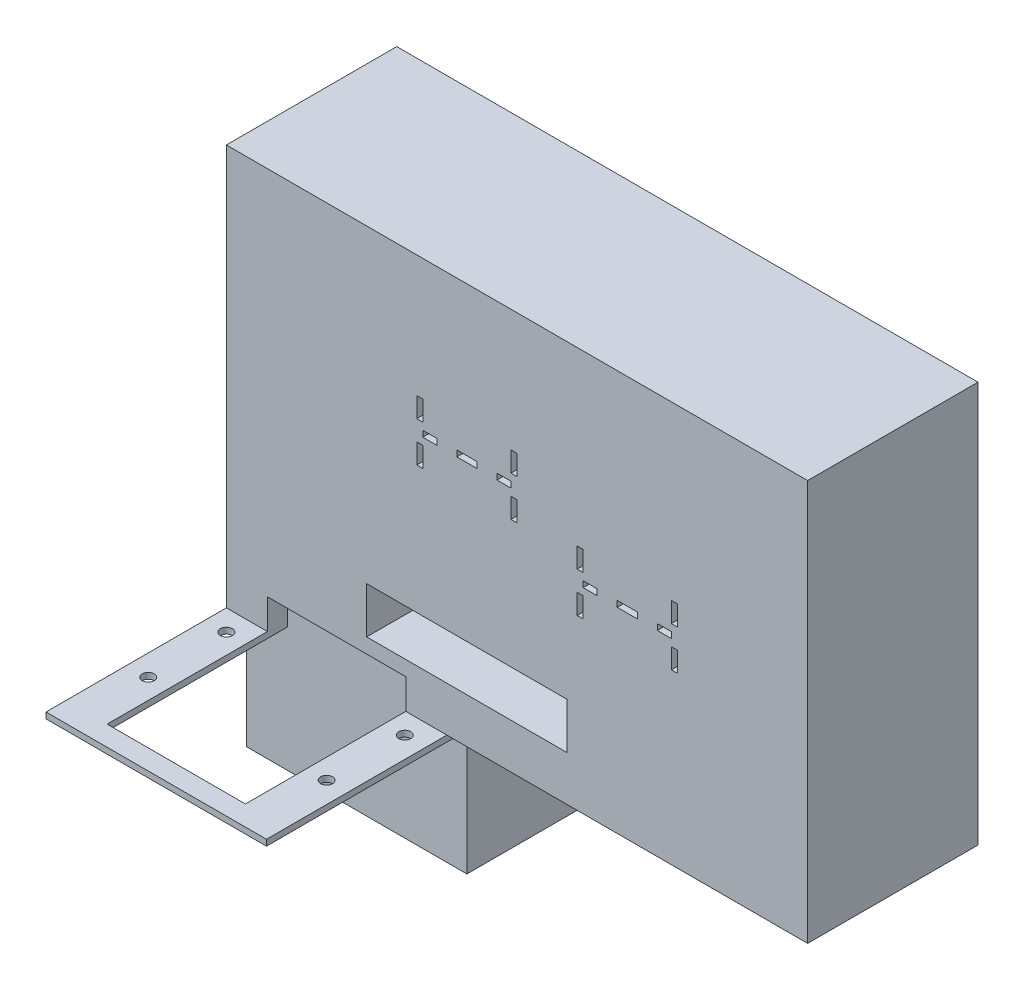
from build123d import *

# Parameters (mm, degrees)
CROQUIS1_W              = 110
CROQUIS1_H              = 65
SALIENTE_EXTRUIR1_DEPTH = 75
CROQUIS3_W              = 110
CROQUIS3_H              = 3
SALIENTE_EXTRUIR2_DEPTH = 70
CROQUIS4_R              = 3
CORTAR_EXTRUIR1_DEPTH   = 70
SALIENTE_EXTRUIR3_DEPTH = 3
CROQUIS7_W              = 290
CROQUIS7_H              = 85
SALIENTE_EXTRUIR4_DEPTH = 200
CROQUIS8_W              = 69
CROQUIS8_H              = 15
CORTAR_EXTRUIR2_DEPTH   = 10
CORTAR_EXTRUIR3_DEPTH   = 50
CROQUIS12_W             = 10
CROQUIS12_H             = 3
CROQUIS12_W_2           = 7
CROQUIS12_W_3           = 3
CROQUIS12_H_2           = 10
CORTAR_EXTRUIR4_DEPTH   = 3


with BuildPart() as part:
    # Croquis1 → Saliente-Extruir1 (new body)
    with BuildSketch(Plane.XY):
        with Locations((-30.634930344, 26.158405172)):
            Rectangle(CROQUIS1_W, CROQUIS1_H)
    extrude(amount=SALIENTE_EXTRUIR1_DEPTH)

    # Croquis3 → Saliente-Extruir2 (add)
    with BuildSketch(Plane.XY.offset(75)):
        with Locations((-30.634930344, 57.158405172)):
            Rectangle(CROQUIS3_W, CROQUIS3_H)
    extrude(amount=SALIENTE_EXTRUIR2_DEPTH)

    # Croquis4 → Cortar-Extruir1 (cut)
    with BuildSketch(Plane.XZ.offset(-55.658405172)):
        with Locations((-75.134930344, 134.5)):
            Circle(CROQUIS4_R)
        with Locations((-75.134930344, 95.5)):
            Circle(CROQUIS4_R)
        with Locations((13.865069656, 134.5)):
            Circle(CROQUIS4_R)
        with Locations((13.865069656, 95.5)):
            Circle(CROQUIS4_R)
        Polygon((-65.134930344, 134.5), (-65.134930344, 75), (3.865069656, 75), (3.865069656, 138), (3.865069656, 145), (-65.134930344, 145), align=None)
    extrude(amount=-CORTAR_EXTRUIR1_DEPTH, mode=Mode.SUBTRACT)

    # Croquis6 → Saliente-Extruir3 (add)
    with BuildSketch(Plane(origin=(0, 58.658405172, 0), x_dir=(1, 0, 0), z_dir=(0, 1, 0))):
        Polygon((-85.634930344, -145), (-85.634930344, -175), (24.365069656, -175), (24.365069656, -145), (3.865069656, -145), (3.865069656, -165), (-65.134930344, -165), (-65.134930344, -145), align=None)
    extrude(amount=-SALIENTE_EXTRUIR3_DEPTH)

    # Croquis7 → Saliente-Extruir4 (add)
    with BuildSketch(Plane(origin=(0, 58.658405172, 0), x_dir=(1, 0, 0), z_dir=(0, 1, 0))):
        with Locations((59.365069656, -42.5)):
            Rectangle(CROQUIS7_W, CROQUIS7_H)
    extrude(amount=SALIENTE_EXTRUIR4_DEPTH)

    # Croquis8 → Cortar-Extruir2 (cut)
    with BuildSketch(Plane.XY.offset(85)):
        with Locations((-30.634930344, 66.158405172)):
            Rectangle(CROQUIS8_W, CROQUIS8_H)
    extrude(amount=-CORTAR_EXTRUIR2_DEPTH, mode=Mode.SUBTRACT)

    # Croquis10 → Cortar-Extruir3 (cut)
    with BuildSketch(Plane.XY.offset(85)):
        Polygon((-0.634930344, 81.0941562), (-15.634930344, 81.0941562), (-15.634930344, 104.0941562), (-0.634930344, 104.0941562), (69.365069656, 104.0941562), (84.365069656, 104.0941562), (84.365069656, 81.0941562), (69.365069656, 81.0941562), align=None)
    extrude(amount=-CORTAR_EXTRUIR3_DEPTH, mode=Mode.SUBTRACT)

    # Croquis12 → Cortar-Extruir4 (cut)
    with BuildSketch(Plane.XY.offset(85)):
        with Locations((34.365069656, 182.876280686)):
            Rectangle(CROQUIS12_W, CROQUIS12_H)
        with Locations((52.865069656, 182.876280686)):
            Rectangle(CROQUIS12_W_2, CROQUIS12_H)
        with Locations((57.865069656, 172.876280686)):
            Rectangle(CROQUIS12_W_3, CROQUIS12_H_2)
        with Locations((57.865069656, 192.876280686)):
            Rectangle(CROQUIS12_W_3, CROQUIS12_H_2)
        with Locations((10.865069656, 192.876280686)):
            Rectangle(CROQUIS12_W_3, CROQUIS12_H_2)
        with Locations((10.865069656, 172.876280686)):
            Rectangle(CROQUIS12_W_3, CROQUIS12_H_2)
        with Locations((15.865069656, 182.876280686)):
            Rectangle(CROQUIS12_W_2, CROQUIS12_H)
        with Locations((114.365069656, 157.876280686)):
            Rectangle(CROQUIS12_W, CROQUIS12_H)
        with Locations((132.865069656, 157.876280686)):
            Rectangle(CROQUIS12_W_2, CROQUIS12_H)
        with Locations((90.865069656, 167.876280686)):
            Rectangle(CROQUIS12_W_3, CROQUIS12_H_2)
        with Locations((90.865069656, 147.876280686)):
            Rectangle(CROQUIS12_W_3, CROQUIS12_H_2)
        with Locations((95.865069656, 157.876280686)):
            Rectangle(CROQUIS12_W_2, CROQUIS12_H)
        with Locations((137.865069656, 167.876280686)):
            Rectangle(CROQUIS12_W_3, CROQUIS12_H_2)
        with Locations((137.865069656, 147.876280686)):
            Rectangle(CROQUIS12_W_3, CROQUIS12_H_2)
    extrude(amount=-CORTAR_EXTRUIR4_DEPTH, mode=Mode.SUBTRACT)


solid = part.part
